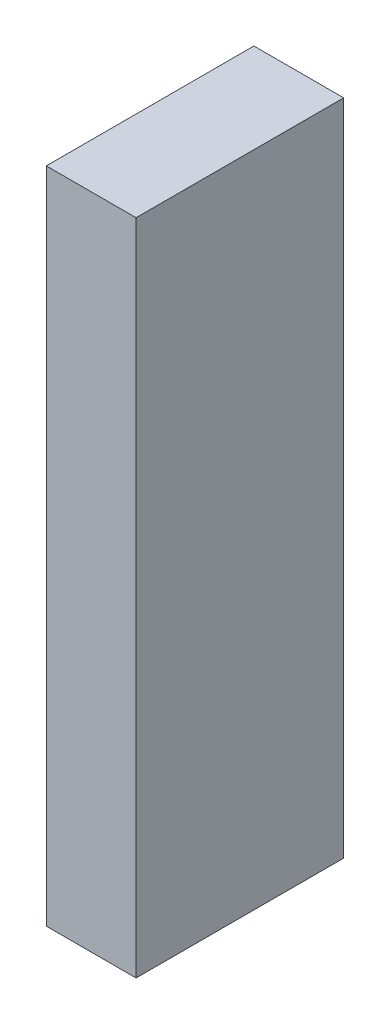
from build123d import *

# Parameters (mm, degrees)
SKETCH1_W           = 38.1
SKETCH1_H           = 88.10625
BOSS_EXTRUDE1_DEPTH = 279.4


with BuildPart() as part:
    # Sketch1 → Boss-Extrude1 (new body)
    with BuildSketch(Plane(origin=(0, 0, 0), x_dir=(1, 0, 0), z_dir=(0, 1, 0))):
        Rectangle(SKETCH1_W, SKETCH1_H)
    extrude(amount=BOSS_EXTRUDE1_DEPTH)


solid = part.part
